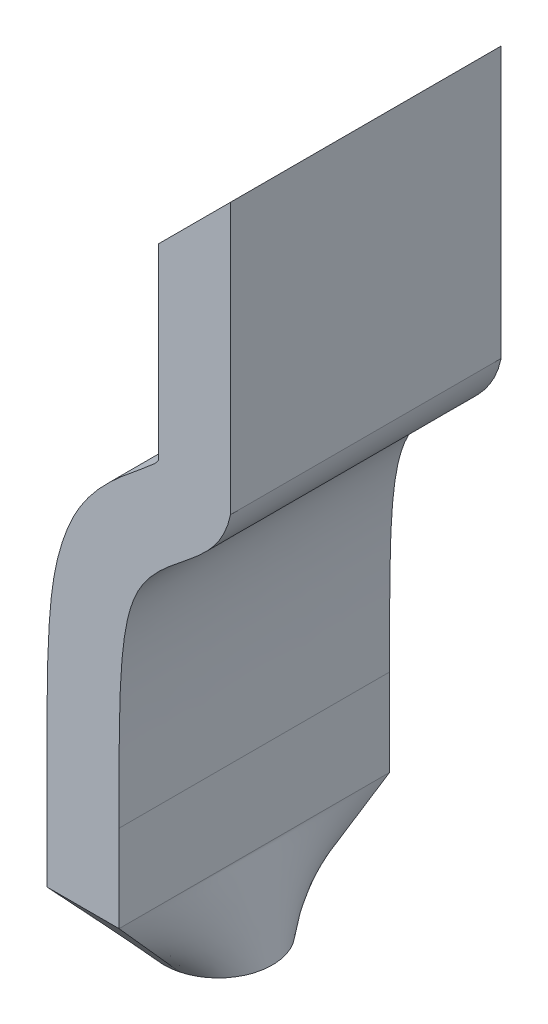
from build123d import *

# Parameters (mm, degrees)
BOSS_EXTRUDE1_DEPTH = 1.5


with BuildPart() as part:
    # Sketch1 → Boss-Extrude1 (new body)
    with BuildSketch(Plane.XY):
        with BuildLine():
            Line((0, 0), (0, 1.5))
            Line((0, 1.5), (-0.4, 1.1))
            Line((-0.4, 1.1), (-0.4, 0.060352875))
            add(Edge.make_bspline(
                [(-0.4, 0.060352875), (-0.409973476, 0.044817545), (-0.423249666, 0.029918985), (-0.562369374, -0.083774644), (-0.839777589, -0.311942138), (-0.977221281, -0.718214966), (-1.008847213, -1.017715193), (-1.018913005, -1.358874566), (-1.018244352, -1.669580342), (-1.018244352, -1.814525752)],
                knots=[0.109484602, 0.109484602, 0.109484602, 0.109484602, 0.220799026, 0.332113451, 0.554742301, 0.666056726, 0.77737115, 0.888685575, 1, 1, 1, 1], degree=3))
            Line((-1.018244352, -1.814525752), (-1.018244352, -2.296742603))
            Line((-1.018244352, -2.296742603), (-0.618244352, -2.296742603))
            Line((-0.618244352, -2.296742603), (-0.618244352, -1.814525752))
            add(Edge.make_bspline(
                [(0, 0), (-0.065932077, -0.313499234), (-0.626607024, -0.397465224), (-0.618244352, -1.183817849), (-0.618244352, -1.814525752)],
                knots=[0, 0, 0, 0, 0.565457771, 1, 1, 1, 1], degree=3))
        make_face()
    extrude(amount=BOSS_EXTRUDE1_DEPTH)

    # Loft1: read off the stored shape, not the designer's step
    # Loft1: loft between two sections, ruled curve by curve
    loft1_from = [
        Edge.make_bspline([(-0.618244352, -2.296742603, 0), (-0.618244352, -2.296742603, 0.125), (-0.618244352, -2.296742603, 0.25), (-0.618244352, -2.296742603, 0.5), (-0.618244352, -2.296742603, 0.625), (-0.618244352, -2.296742603, 0.875), (-0.618244352, -2.296742603, 1), (-0.618244352, -2.296742603, 1.25), (-0.618244352, -2.296742603, 1.375), (-0.618244352, -2.296742603, 1.5)], [0, 0, 0, 0, 0.25, 0.25, 0.5, 0.5, 0.75, 0.75, 1, 1, 1, 1], 3),
        Edge.make_bspline([(-0.618244352, -2.296742603, 1.5), (-0.684911019, -2.296742603, 1.5), (-0.751577685, -2.296742603, 1.5), (-0.884911019, -2.296742603, 1.5), (-0.951577685, -2.296742603, 1.5), (-1.018244352, -2.296742603, 1.5)], [0, 0, 0, 0, 0.5, 0.5, 1, 1, 1, 1], 3),
        Edge.make_bspline([(-1.018244352, -2.296742603, 0), (-0.951577685, -2.296742603, 0), (-0.884911019, -2.296742603, 0), (-0.751577685, -2.296742603, 0), (-0.684911019, -2.296742603, 0), (-0.618244352, -2.296742603, 0)], [0, 0, 0, 0, 0.5, 0.5, 1, 1, 1, 1], 3),
        Edge.make_bspline([(-1.018244352, -2.296742603, 1.5), (-1.018244352, -2.296742603, 1.375), (-1.018244352, -2.296742603, 1.25), (-1.018244352, -2.296742603, 1), (-1.018244352, -2.296742603, 0.875), (-1.018244352, -2.296742603, 0.625), (-1.018244352, -2.296742603, 0.5), (-1.018244352, -2.296742603, 0.25), (-1.018244352, -2.296742603, 0.125), (-1.018244352, -2.296742603, 0)], [0, 0, 0, 0, 0.25, 0.25, 0.5, 0.5, 0.75, 0.75, 1, 1, 1, 1], 3),
    ]
    loft1_to = [
        Edge.make_bspline([(-0.740945557, -2.796742603, 0.460129518), (-0.694265059, -2.796742603, 0.472577651), (-0.640218461, -2.796742603, 0.499422848), (-0.550575921, -2.796742603, 0.598885017), (-0.518244352, -2.796742603, 0.673172169), (-0.518244352, -2.796742603, 0.826827831), (-0.550575921, -2.796742603, 0.901114983), (-0.640218461, -2.796742603, 1.000577152), (-0.694265059, -2.796742603, 1.027422349), (-0.740945557, -2.796742603, 1.039870482)], [0, 0, 0, 0, 0.25, 0.25, 0.5, 0.5, 0.75, 0.75, 1, 1, 1, 1], 3),
        Edge.make_bspline([(-0.740945557, -2.796742603, 1.039870482), (-0.765841822, -2.796742603, 1.046509486), (-0.792043087, -2.796742603, 1.049828988), (-0.844445617, -2.796742603, 1.049828988), (-0.870646882, -2.796742603, 1.046509486), (-0.895543147, -2.796742603, 1.039870482)], [0, 0, 0, 0, 0.5, 0.5, 1, 1, 1, 1], 3),
        Edge.make_bspline([(-0.895543147, -2.796742603, 0.460129518), (-0.870646882, -2.796742603, 0.453490514), (-0.844445617, -2.796742603, 0.450171012), (-0.792043087, -2.796742603, 0.450171012), (-0.765841822, -2.796742603, 0.453490514), (-0.740945557, -2.796742603, 0.460129518)], [0, 0, 0, 0, 0.5, 0.5, 1, 1, 1, 1], 3),
        Edge.make_bspline([(-0.895543147, -2.796742603, 1.039870482), (-0.942223645, -2.796742603, 1.027422349), (-0.996270243, -2.796742603, 1.000577152), (-1.085912783, -2.796742603, 0.901114983), (-1.118244352, -2.796742603, 0.826827831), (-1.118244352, -2.796742603, 0.673172169), (-1.085912783, -2.796742603, 0.598885017), (-0.996270243, -2.796742603, 0.499422848), (-0.942223645, -2.796742603, 0.472577651), (-0.895543147, -2.796742603, 0.460129518)], [0, 0, 0, 0, 0.25, 0.25, 0.5, 0.5, 0.75, 0.75, 1, 1, 1, 1], 3),
    ]
    loft1 = Solid(Shell([*[Face.make_surface_from_curves(loft1_from[k], loft1_to[k]) for k in range(4)], Face(Wire(loft1_from)), Face(Wire(loft1_to))]))
    add(loft1)


solid = part.part
